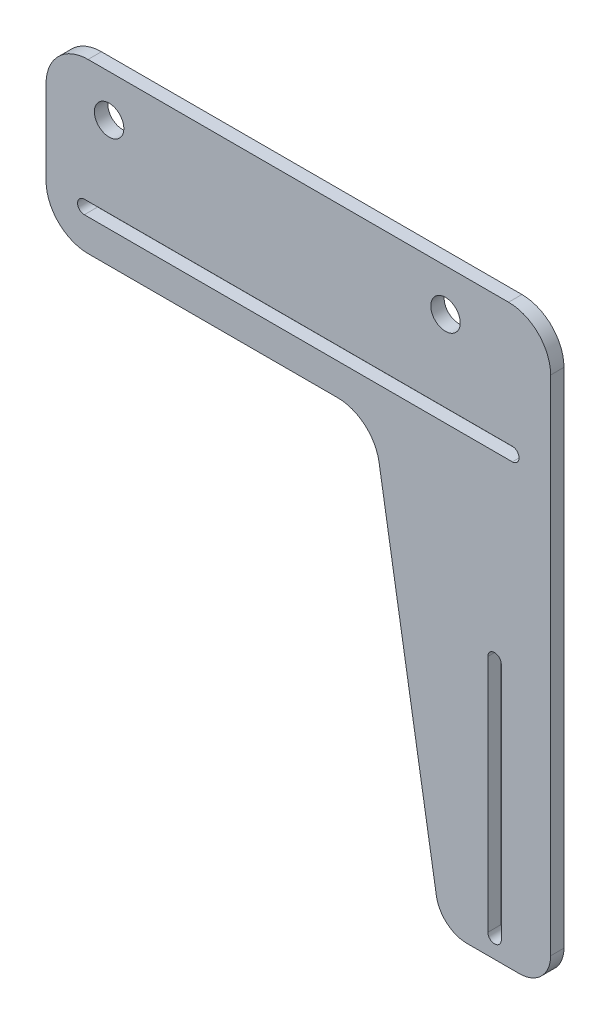
from build123d import *

# Parameters (mm, degrees)
BASE_FLANGE1_DEPTH       = 3.175
CUT_EXTRUDE1_DEPTH       = 102.670918338
CUT_EXTRUDE2_DEPTH       = 102.670918338
F_7_0_7_DIAMETER_HOLE1_D = 7


# Sheet-metal steps are written as plain solids
with BuildPart() as part:
    # Sketch11 → Base-Flange1 (new body)
    with BuildSketch(Plane.XY.offset(3.175)):
        with BuildLine():
            Line((40.132559776, -82.017650604), (52.6, -82.017650604))
            ThreePointArc((52.6, -82.017650604), (57.832590181, -79.850240785), (60, -74.617650604))
            Line((60, -74.617650604), (60, 45))
            ThreePointArc((60, 45), (57.071067812, 52.071067812), (50, 55))
            Line((50, 55), (-50, 55))
            ThreePointArc((-50, 55), (-57.071067812, 52.071067812), (-60, 45))
            Line((-60, 45), (-60, 25))
            ThreePointArc((-60, 25), (-57.071067812, 17.928932188), (-50, 15))
            Line((-50, 15), (9.334375382, 15))
            ThreePointArc((9.334375382, 15), (15.803139956, 12.62594813), (19.200468004, 6.631016977))
            Line((19.200468004, 6.631016977), (32.831651236, -75.824603167))
            ThreePointArc((32.831651236, -75.824603167), (35.345673992, -80.260852221), (40.132559776, -82.017650604))
        make_face()
    extrude(amount=-BASE_FLANGE1_DEPTH)

    # Sketch16 → Cut-Extrude1 (cut, through all)
    with BuildSketch(Plane.XY.offset(3.175)):
        with BuildLine():
            Line((45.071829224, -20.429999447), (45.071829224, -77.229999447))
            ThreePointArc((45.071829224, -77.229999447), (46.671829224, -78.829999447), (48.271829224, -77.229999447))
            Line((48.271829224, -77.229999447), (48.271829224, -20.429999447))
            ThreePointArc((48.271829224, -20.429999447), (46.671829224, -18.829999447), (45.071829224, -20.429999447))
        make_face()
    extrude(amount=-CUT_EXTRUDE1_DEPTH, mode=Mode.SUBTRACT)

    # Sketch17 → Cut-Extrude2 (cut, through all)
    with BuildSketch(Plane(origin=(0, 0, 0), x_dir=(-1, 0, 0), z_dir=(0, 0, -1))):
        with BuildLine():
            Line((50.9, 25.770000553), (-50.9, 25.770000553))
            ThreePointArc((-50.9, 25.770000553), (-52.5, 24.170000553), (-50.9, 22.570000553))
            Line((-50.9, 22.570000553), (50.9, 22.570000553))
            ThreePointArc((50.9, 22.570000553), (52.5, 24.170000553), (50.9, 25.770000553))
        make_face()
    extrude(amount=-CUT_EXTRUDE2_DEPTH, mode=Mode.SUBTRACT)

    # Ø7.0 (7) Diameter Hole1 (through all)
    with Locations(Plane.XY.offset(3.175)):
        with Locations((35, 45), (-45, 45)):
            Hole(F_7_0_7_DIAMETER_HOLE1_D / 2)


solid = part.part
